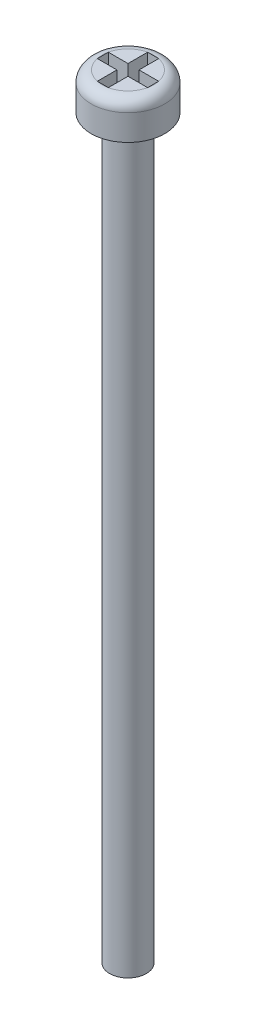
from build123d import *

# Parameters (mm, degrees)
BOSS_EXTRUDE1_DEPTH      = 10
BOSS_EXTRUDE1_DEPTH_BACK = 11
SKETCH1_R                = 0.5
SKETCH2_R                = 1
BOSS_EXTRUDE2_DEPTH      = 1
FILLET1_R                = 0.3
CUT_EXTRUDE1_DEPTH       = 0.6


with BuildPart() as part:
    # Sketch1 → Boss-Extrude1 (new, two sides: drawn at the far end of the back side and taken through both)
    with BuildSketch(Plane(origin=(0, 0, 0), x_dir=(1, 0, 0), z_dir=(0, 1, 0)).offset(-BOSS_EXTRUDE1_DEPTH_BACK)):
        Circle(SKETCH1_R)
    extrude(amount=BOSS_EXTRUDE1_DEPTH + BOSS_EXTRUDE1_DEPTH_BACK)

    # Sketch2 → Boss-Extrude2 (add)
    with BuildSketch(Plane(origin=(0, 10, 0), x_dir=(1, 0, 0), z_dir=(0, 1, 0))):
        Circle(SKETCH2_R)
    extrude(amount=-BOSS_EXTRUDE2_DEPTH)

    # Fillet1
    fillet1_edges = [part.edges().sort_by_distance(p)[0] for p in [
        (-1, 10, 0),
    ]]
    fillet(fillet1_edges, radius=FILLET1_R)

    # Sketch3 → Cut-Extrude1 (cut)
    with BuildSketch(Plane(origin=(0, 10, 0), x_dir=(1, 0, 0), z_dir=(0, 1, 0))):
        Polygon((-0.15, 0.15), (-0.15, 0.683739717), (0.15, 0.683739717), (0.15, 0.15), (0.683739717, 0.15), (0.683739717, -0.15), (0.15, -0.15), (0.15, -0.683739717), (-0.15, -0.683739717), (-0.15, -0.15), (-0.683739717, -0.15), (-0.683739717, 0.15), align=None)
    extrude(amount=-CUT_EXTRUDE1_DEPTH, mode=Mode.SUBTRACT)


solid = part.part
